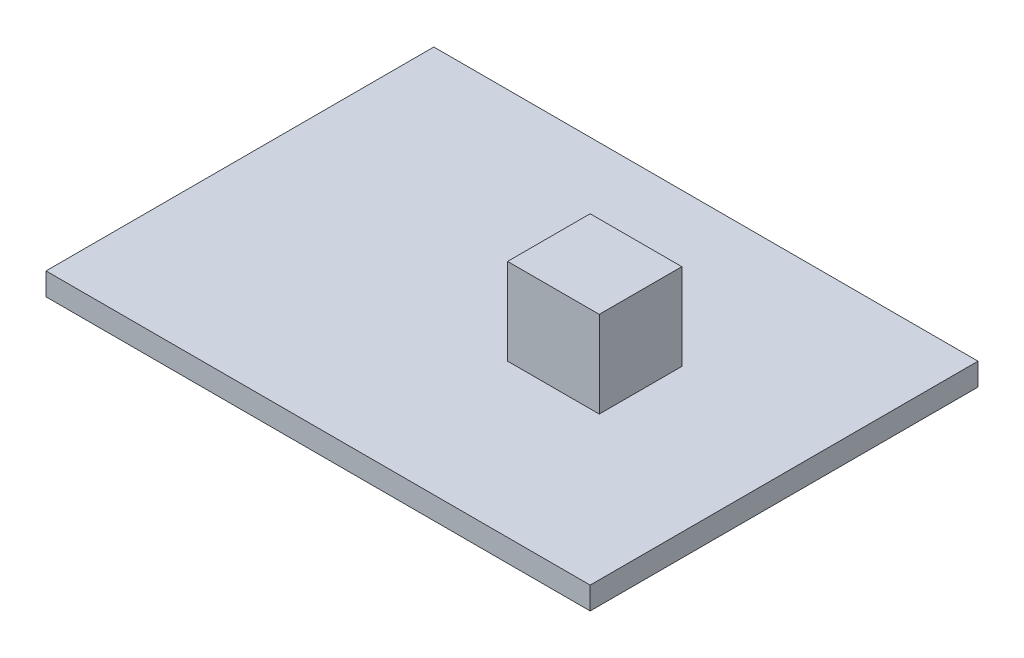
from build123d import *

# Parameters (mm, degrees)
SKETCH1_W           = 63
SKETCH1_H           = 44.9
BOSS_EXTRUDE1_DEPTH = 2.6
SKETCH3_W           = 10.613779313
SKETCH3_H           = 9.558952204
BOSS_EXTRUDE2_DEPTH = 10


with BuildPart() as part:
    # Sketch1 → Boss-Extrude1 (new body)
    with BuildSketch(Plane(origin=(0, 0, 0), x_dir=(1, 0, 0), z_dir=(0, 1, 0))):
        with Locations((-4.421311475, 0.45)):
            Rectangle(SKETCH1_W, SKETCH1_H)
    extrude(amount=BOSS_EXTRUDE1_DEPTH)

    # Sketch3 → Boss-Extrude2 (add)
    with BuildSketch(Plane(origin=(0, 2.6, 0), x_dir=(1, 0, 0), z_dir=(0, 1, 0))):
        with Locations((5.152841445, 0.45)):
            Rectangle(SKETCH3_W, SKETCH3_H)
    extrude(amount=BOSS_EXTRUDE2_DEPTH)


solid = part.part
